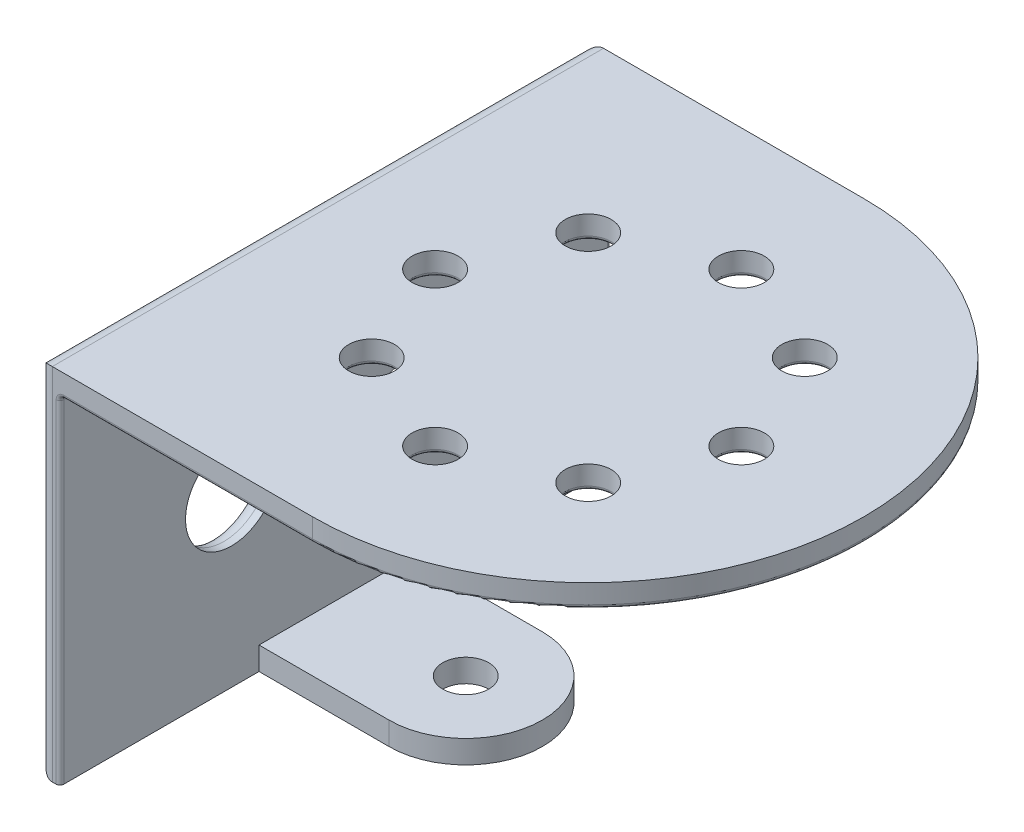
from build123d import *

# Parameters (mm, degrees)
CROQUIS1_W              = 36
CROQUIS1_H              = 22
CROQUIS1_R              = 1.5
CROQUIS1_R_2            = 3
CROQUIS1_R_3            = 1.75
SALIENTE_EXTRUIR1_DEPTH = 1.5
SALIENTE_EXTRUIR3_START = -22
SALIENTE_EXTRUIR3_DEPTH = 1.5
SALIENTE_EXTRUIR4_START = 22
CROQUIS4_W              = 1.5
CROQUIS4_H              = 10
SALIENTE_EXTRUIR4_DEPTH = 1.5
CORTAR_EXTRUIR1_REACH   = 48.607
CROQUIS5_R              = 1.5
CORTAR_EXTRUIR2_REACH   = 48.607
CROQUIS7_R              = 1.5
REDONDEO2_R             = 1
REDONDEO3_R             = 0.25


with BuildPart() as part:
    # Croquis1 → Saliente-Extruir1 (new body)
    with BuildSketch(Plane(origin=(0, 0, 0), x_dir=(0, 0, -1), z_dir=(1, 0, 0))):
        Rectangle(CROQUIS1_W, CROQUIS1_H)
        with Locations((13.8, 8.75)):
            Circle(CROQUIS1_R, mode=Mode.SUBTRACT)
        with Locations((-6.8, 0)):
            Circle(CROQUIS1_R_2, mode=Mode.SUBTRACT)
        with Locations(Location((13.8, -8.75, 0), (0, 0, 180))):
            Circle(CROQUIS1_R, mode=Mode.SUBTRACT)
        with Locations((4.2, 0)):
            Circle(CROQUIS1_R_3, mode=Mode.SUBTRACT)
    extrude(amount=SALIENTE_EXTRUIR1_DEPTH)

    # Croquis3<2> → Saliente-Extruir3 (add)
    with BuildSketch(Plane.XZ.offset(11).offset(SALIENTE_EXTRUIR3_START)):
        with BuildLine():
            Line((18, -18), (0, -18))
            Line((0, -18), (0, 18))
            Line((0, 18), (18, 18))
            ThreePointArc((18, 18), (36, 0), (18, -18))
        make_face()
    extrude(amount=-SALIENTE_EXTRUIR3_DEPTH)

    # Croquis4 → Saliente-Extruir4 (add)
    with BuildSketch(Plane(origin=(0, 11, 0), x_dir=(-1, 0, 0), z_dir=(0, -1, 0)).offset(SALIENTE_EXTRUIR4_START)):
        with BuildLine():
            Line((-1.5, -5), (-1.5, 5))
            Line((-1.5, 5), (-10, 5))
            ThreePointArc((-10, 5), (-15, 0), (-10, -5))
            Line((-10, -5), (-1.5, -5))
        make_face()
        with Locations((-0.75, 0)):
            Rectangle(CROQUIS4_W, CROQUIS4_H)
    extrude(amount=-SALIENTE_EXTRUIR4_DEPTH)

    # Croquis5 → Cortar-Extruir1 (cut, up to next)
    with BuildSketch(Plane(origin=(0, -11, 0), x_dir=(-1, 0, 0), z_dir=(0, -1, 0)), mode=Mode.PRIVATE) as cortar_extruir1_sk1:
        with Locations(Location((-10, 0, 0), (0, 0, 90))):
            Circle(CROQUIS5_R)
    cortar_extruir1_tool1 = extrude(cortar_extruir1_sk1.sketch, amount=-CORTAR_EXTRUIR1_REACH, mode=Mode.PRIVATE) & part.part
    add(cortar_extruir1_tool1.solids().sort_by_distance((10, -11, 0))[0], mode=Mode.SUBTRACT)

    # Croquis7 → Cortar-Extruir2 (cut, up to next)
    with BuildSketch(Plane(origin=(0, 12.5, 0), x_dir=(-1, 0, 0), z_dir=(0, 1, 0)), mode=Mode.PRIVATE) as cortar_extruir2_sk1:
        with Locations(Location((-8, 0, 0), (0, 0, 90))):
            Circle(CROQUIS7_R)
    cortar_extruir2_tool1 = extrude(cortar_extruir2_sk1.sketch, amount=-CORTAR_EXTRUIR2_REACH, mode=Mode.PRIVATE) & part.part
    # Croquis7 → Cortar-Extruir2 (cut, up to next)
    with BuildSketch(Plane(origin=(0, 12.5, 0), x_dir=(-1, 0, 0), z_dir=(0, 1, 0)), mode=Mode.PRIVATE) as cortar_extruir2_sk2:
        with Locations(Location((-10.928932188, -7.071067812, 0), (0, 0, 90))):
            Circle(CROQUIS7_R)
    cortar_extruir2_tool2 = extrude(cortar_extruir2_sk2.sketch, amount=-CORTAR_EXTRUIR2_REACH, mode=Mode.PRIVATE) & part.part
    # Croquis7 → Cortar-Extruir2 (cut, up to next)
    with BuildSketch(Plane(origin=(0, 12.5, 0), x_dir=(-1, 0, 0), z_dir=(0, 1, 0)), mode=Mode.PRIVATE) as cortar_extruir2_sk3:
        with Locations(Location((-18, -10, 0), (0, 0, 90))):
            Circle(CROQUIS7_R)
    cortar_extruir2_tool3 = extrude(cortar_extruir2_sk3.sketch, amount=-CORTAR_EXTRUIR2_REACH, mode=Mode.PRIVATE) & part.part
    # Croquis7 → Cortar-Extruir2 (cut, up to next)
    with BuildSketch(Plane(origin=(0, 12.5, 0), x_dir=(-1, 0, 0), z_dir=(0, 1, 0)), mode=Mode.PRIVATE) as cortar_extruir2_sk4:
        with Locations(Location((-25.071067812, -7.071067812, 0), (0, 0, 90))):
            Circle(CROQUIS7_R)
    cortar_extruir2_tool4 = extrude(cortar_extruir2_sk4.sketch, amount=-CORTAR_EXTRUIR2_REACH, mode=Mode.PRIVATE) & part.part
    # Croquis7 → Cortar-Extruir2 (cut, up to next)
    with BuildSketch(Plane(origin=(0, 12.5, 0), x_dir=(-1, 0, 0), z_dir=(0, 1, 0)), mode=Mode.PRIVATE) as cortar_extruir2_sk5:
        with Locations(Location((-28, 0, 0), (0, 0, 90))):
            Circle(CROQUIS7_R)
    cortar_extruir2_tool5 = extrude(cortar_extruir2_sk5.sketch, amount=-CORTAR_EXTRUIR2_REACH, mode=Mode.PRIVATE) & part.part
    # Croquis7 → Cortar-Extruir2 (cut, up to next)
    with BuildSketch(Plane(origin=(0, 12.5, 0), x_dir=(-1, 0, 0), z_dir=(0, 1, 0)), mode=Mode.PRIVATE) as cortar_extruir2_sk6:
        with Locations(Location((-25.071067812, 7.071067812, 0), (0, 0, 90))):
            Circle(CROQUIS7_R)
    cortar_extruir2_tool6 = extrude(cortar_extruir2_sk6.sketch, amount=-CORTAR_EXTRUIR2_REACH, mode=Mode.PRIVATE) & part.part
    # Croquis7 → Cortar-Extruir2 (cut, up to next)
    with BuildSketch(Plane(origin=(0, 12.5, 0), x_dir=(-1, 0, 0), z_dir=(0, 1, 0)), mode=Mode.PRIVATE) as cortar_extruir2_sk7:
        with Locations(Location((-18, 10, 0), (0, 0, 90))):
            Circle(CROQUIS7_R)
    cortar_extruir2_tool7 = extrude(cortar_extruir2_sk7.sketch, amount=-CORTAR_EXTRUIR2_REACH, mode=Mode.PRIVATE) & part.part
    # Croquis7 → Cortar-Extruir2 (cut, up to next)
    with BuildSketch(Plane(origin=(0, 12.5, 0), x_dir=(-1, 0, 0), z_dir=(0, 1, 0)), mode=Mode.PRIVATE) as cortar_extruir2_sk8:
        with Locations(Location((-10.928932188, 7.071067812, 0), (0, 0, 90))):
            Circle(CROQUIS7_R)
    cortar_extruir2_tool8 = extrude(cortar_extruir2_sk8.sketch, amount=-CORTAR_EXTRUIR2_REACH, mode=Mode.PRIVATE) & part.part
    add(cortar_extruir2_tool1.solids().sort_by_distance((8, 12.5, 0))[0], mode=Mode.SUBTRACT)
    add(cortar_extruir2_tool2.solids().sort_by_distance((10.928932, 12.5, -7.071068))[0], mode=Mode.SUBTRACT)
    add(cortar_extruir2_tool3.solids().sort_by_distance((18, 12.5, -10))[0], mode=Mode.SUBTRACT)
    add(cortar_extruir2_tool4.solids().sort_by_distance((25.071068, 12.5, -7.071068))[0], mode=Mode.SUBTRACT)
    add(cortar_extruir2_tool5.solids().sort_by_distance((28, 12.5, 0))[0], mode=Mode.SUBTRACT)
    add(cortar_extruir2_tool6.solids().sort_by_distance((25.071068, 12.5, 7.071068))[0], mode=Mode.SUBTRACT)
    add(cortar_extruir2_tool7.solids().sort_by_distance((18, 12.5, 10))[0], mode=Mode.SUBTRACT)
    add(cortar_extruir2_tool8.solids().sort_by_distance((10.928932, 12.5, 7.071068))[0], mode=Mode.SUBTRACT)

    # Redondeo2
    # the kernel refuses this fillet: 1 mm, written as the material it takes off along each edge
    with BuildSketch(Plane(origin=(0, 8.75, -13.8), x_dir=(0, 0, -1), z_dir=(0, -1, 0))) as redondeo2_piece_1:
        with BuildLine():
            CenterArc((1.5 + REDONDEO2_R, REDONDEO2_R), REDONDEO2_R, 180, 90)
            Line((1.5, REDONDEO2_R), (1.5, 0))
            Line((1.5, 0), (1.5 + REDONDEO2_R, 0))
        make_face()
    revolve(axis=Axis((0, 8.75, -13.8), (1, 0, 0)), mode=Mode.SUBTRACT)
    with BuildSketch(Plane(origin=(0, 0, 6.8), x_dir=(0, 0, -1), z_dir=(0, -1, 0))) as redondeo2_piece_2:
        with BuildLine():
            CenterArc((3 + REDONDEO2_R, REDONDEO2_R), REDONDEO2_R, 180, 90)
            Line((3, REDONDEO2_R), (3, 0))
            Line((3, 0), (3 + REDONDEO2_R, 0))
        make_face()
    revolve(axis=Axis((0, 0, 6.8), (1, 0, 0)), mode=Mode.SUBTRACT)
    with BuildSketch(Plane(origin=(0, -8.75, -13.8), x_dir=(0, 0, 1), z_dir=(0, 1, 0))) as redondeo2_piece_3:
        with BuildLine():
            CenterArc((1.5 + REDONDEO2_R, REDONDEO2_R), REDONDEO2_R, 180, 90)
            Line((1.5, REDONDEO2_R), (1.5, 0))
            Line((1.5, 0), (1.5 + REDONDEO2_R, 0))
        make_face()
    revolve(axis=Axis((0, -8.75, -13.8), (1, 0, 0)), mode=Mode.SUBTRACT)
    with BuildSketch(Plane(origin=(0, 0, -4.2), x_dir=(0, 0, -1), z_dir=(0, -1, 0))) as redondeo2_piece_4:
        with BuildLine():
            CenterArc((1.75 + REDONDEO2_R, REDONDEO2_R), REDONDEO2_R, 180, 90)
            Line((1.75, REDONDEO2_R), (1.75, 0))
            Line((1.75, 0), (1.75 + REDONDEO2_R, 0))
        make_face()
    revolve(axis=Axis((0, 0, -4.2), (1, 0, 0)), mode=Mode.SUBTRACT)
    with BuildSketch(Plane(origin=(0, 12.5, -20.5), x_dir=(0, -1, 0), z_dir=(0, 0, 1))) as redondeo2_piece_5:
        with BuildLine():
            CenterArc((REDONDEO2_R, REDONDEO2_R), REDONDEO2_R, 180, 90)
            Line((0, REDONDEO2_R), (0, 0))
            Line((0, 0), (REDONDEO2_R, 0))
        make_face()
    extrude(amount=41, mode=Mode.SUBTRACT)
    with BuildSketch(Plane(origin=(0, -11, 20.5), x_dir=(1, 0, 0), z_dir=(0, 0, -1))) as redondeo2_piece_6:
        with BuildLine():
            CenterArc((REDONDEO2_R, -REDONDEO2_R), REDONDEO2_R, 90, 90)
            Line((0, -REDONDEO2_R), (0, 0))
            Line((0, 0), (REDONDEO2_R, 0))
        make_face()
    extrude(amount=41, mode=Mode.SUBTRACT)
    with BuildSketch(Plane(origin=(0, 15, 18), x_dir=(0, 0, -1), z_dir=(0, -1, 0)), Plane(origin=(0, -13.5, -18), x_dir=(0, 0, 1), z_dir=(0, 1, 0))) as redondeo2_piece_7:
        with BuildLine():
            CenterArc((REDONDEO2_R, REDONDEO2_R), REDONDEO2_R, 180, 90)
            Line((0, REDONDEO2_R), (0, 0))
            Line((0, 0), (REDONDEO2_R, 0))
        make_face()
    extrude(amount=28.5, mode=Mode.SUBTRACT)

    # Redondeo3
    redondeo3_edges = [part.edges().sort_by_distance(p)[0] for p in [
        (1.5, 0, 18),
        (9.75, 11, -18),
        (36, 11, 0),
        (9.75, 11, 18),
        (1.5, 0, -18),
        (10.928932188, 11, 5.571067812),
        (18, 11, 8.5),
        (25.071067812, 11, 5.571067812),
        (28, 11, -1.5),
        (25.071067812, 11, -8.571067812),
        (18, 11, -11.5),
        (1.5, 11, 0),
        (10.928932188, 11, -8.571067812),
        (8, 11, -1.5),
    ]]
    fillet(redondeo3_edges, radius=REDONDEO3_R)


solid = part.part
